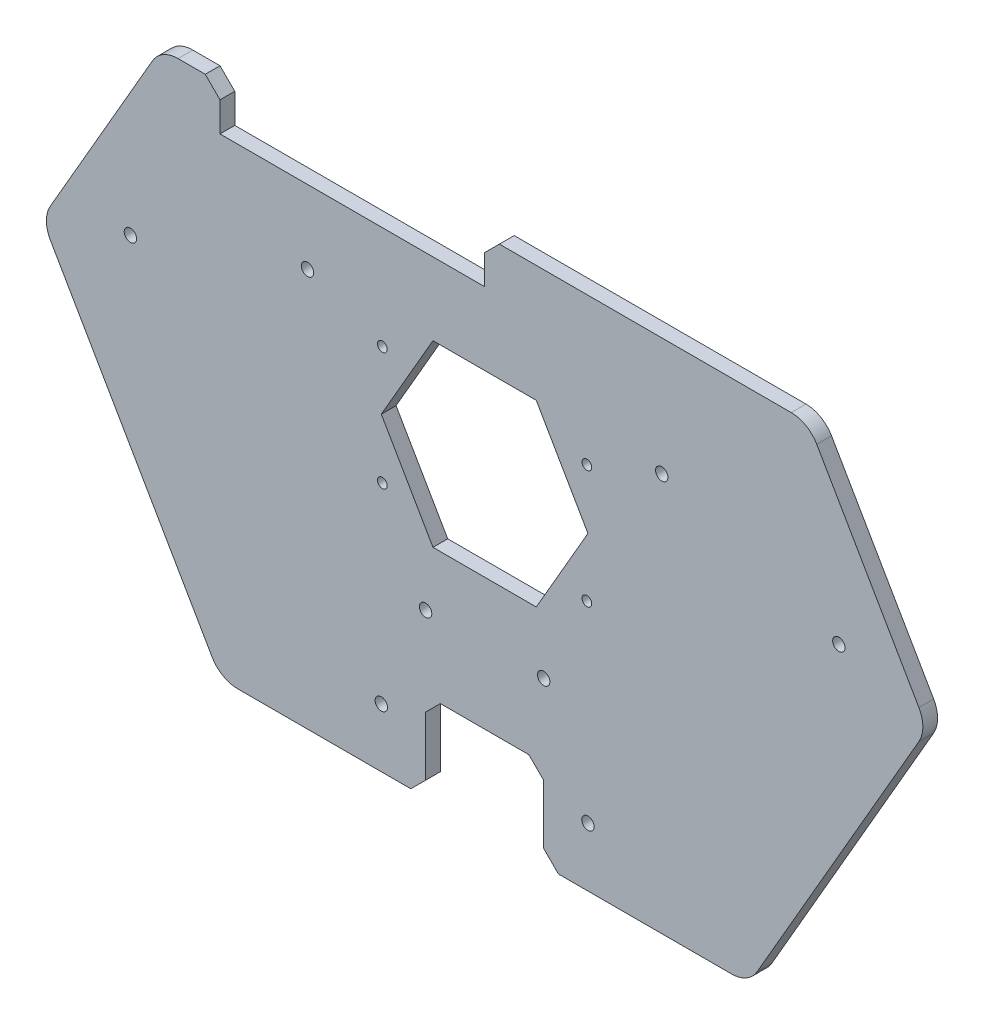
from build123d import *

# Parameters (mm, degrees)
EXTRUDE_1_DEPTH          = 5
CUT_EXTRUDE_2_DEPTH      = 199.494332413
CUT_EXTRUDE_2_DEPTH_BACK = 199.494332413
CUT_EXTRUDE_3_REACH      = 200.494
CHAMFER_1_SIZE           = 5
CUT_EXTRUDE_6_DEPTH      = 199.494332413
CUT_EXTRUDE_6_DEPTH_BACK = 199.494332413
CHAMFER_2_SIZE           = 5
CUT_EXTRUDE_7_REACH      = 185.111
SKETCH_6_R               = 2.1
FILLET_1_R               = 10
M4X0_7_1_D               = 3.3
M4X0_7_1_DEPTH           = 11.5
M4X0_7_1_TIP             = 0.991420021


with BuildPart() as part:
    # 草圖1 → 填料-伸長1 (new body)
    with BuildSketch(Plane.XY):
        Polygon((150, 0), (75, 129.903810568), (-75, 129.903810568), (-150, 0), (-75, -129.903810568), (75, -129.903810568), align=None)
    extrude(amount=EXTRUDE_1_DEPTH)

    # 草圖3 → 除料-伸長2 (cut, two sides: drawn at the far end of the back side and taken through both)
    with BuildSketch(Plane.XY.offset(5).offset(-CUT_EXTRUDE_2_DEPTH_BACK)):
        Polygon((-774.886138932, 69.903810568), (-109.641016151, 69.903810568), (-89.641016151, 69.903810568), (-89.641016151, 54.903810568), (0, 54.903810568), (0, 69.903810568), (109.641016151, 69.903810568), (774.886138932, 69.903810568), (774.886138932, 1400.394056128), (-774.886138932, 1400.394056128), align=None)
    extrude(amount=CUT_EXTRUDE_2_DEPTH + CUT_EXTRUDE_2_DEPTH_BACK, mode=Mode.SUBTRACT)

    # 草圖4 → 除料-伸長3 (cut, up to next)
    with BuildSketch(Plane.XY.offset(5), mode=Mode.PRIVATE) as cut_extrude_3_sk1:
        Polygon((35, 0), (17.5, 30.310889132), (-17.5, 30.310889132), (-35, 0), (-17.5, -30.310889132), (17.5, -30.310889132), align=None)
    cut_extrude_3_tool1 = extrude(cut_extrude_3_sk1.sketch, amount=-CUT_EXTRUDE_3_REACH, mode=Mode.PRIVATE) & part.part
    add(cut_extrude_3_tool1.solids().sort_by_distance((0, 0, 5))[0], mode=Mode.SUBTRACT)

    # 導角1
    chamfer_1_edges = [part.edges().sort_by_distance(p)[0] for p in [
        (0, 69.903810568, 2.5),
        (-89.641016151, 69.903810568, 2.5),
    ]]
    chamfer(chamfer_1_edges, length=CHAMFER_1_SIZE)

    # 草圖5 → 除料-伸長6 (cut, two sides: drawn at the far end of the back side and taken through both)
    with BuildSketch(Plane.XY.offset(5).offset(-CUT_EXTRUDE_6_DEPTH_BACK)):
        Polygon((-692.345987228, -104.903810568), (-89.43375673, -104.903810568), (-20, -104.903810568), (-20, -74.903810568), (20, -74.903810568), (20, -104.903810568), (89.43375673, -104.903810568), (692.345987228, -104.903810568), (692.345987228, -1310.728271565), (-692.345987228, -1310.728271565), align=None)
    extrude(amount=CUT_EXTRUDE_6_DEPTH + CUT_EXTRUDE_6_DEPTH_BACK, mode=Mode.SUBTRACT)

    # 導角2
    chamfer_2_edges = [part.edges().sort_by_distance(p)[0] for p in [
        (20, -104.903810568, 2.5),
        (20, -74.903810568, 2.5),
        (-20, -74.903810568, 2.5),
        (-20, -104.903810568, 2.5),
    ]]
    chamfer(chamfer_2_edges, length=CHAMFER_2_SIZE)

    # 草圖6 → 除料-伸長7 (cut, up to next)
    with BuildSketch(Plane.XY.offset(5), mode=Mode.PRIVATE) as cut_extrude_7_sk1:
        with Locations((-35, -85)):
            Circle(SKETCH_6_R)
    cut_extrude_7_tool1 = extrude(cut_extrude_7_sk1.sketch, amount=-CUT_EXTRUDE_7_REACH, mode=Mode.PRIVATE) & part.part
    # 草圖6 → 除料-伸長7 (cut, up to next)
    with BuildSketch(Plane.XY.offset(5), mode=Mode.PRIVATE) as cut_extrude_7_sk2:
        with Locations((-120, 10)):
            Circle(SKETCH_6_R)
    cut_extrude_7_tool2 = extrude(cut_extrude_7_sk2.sketch, amount=-CUT_EXTRUDE_7_REACH, mode=Mode.PRIVATE) & part.part
    # 草圖6 → 除料-伸長7 (cut, up to next)
    with BuildSketch(Plane.XY.offset(5), mode=Mode.PRIVATE) as cut_extrude_7_sk3:
        with Locations((-60, 30)):
            Circle(SKETCH_6_R)
    cut_extrude_7_tool3 = extrude(cut_extrude_7_sk3.sketch, amount=-CUT_EXTRUDE_7_REACH, mode=Mode.PRIVATE) & part.part
    # 草圖6 → 除料-伸長7 (cut, up to next)
    with BuildSketch(Plane.XY.offset(5), mode=Mode.PRIVATE) as cut_extrude_7_sk4:
        with Locations((-20, -50)):
            Circle(SKETCH_6_R)
    cut_extrude_7_tool4 = extrude(cut_extrude_7_sk4.sketch, amount=-CUT_EXTRUDE_7_REACH, mode=Mode.PRIVATE) & part.part
    cut_extrude_7_1 = cut_extrude_7_tool1.solids().sort_by_distance((-35, -85, 5))[0]
    add(cut_extrude_7_1, mode=Mode.SUBTRACT)
    cut_extrude_7_2 = cut_extrude_7_tool2.solids().sort_by_distance((-120, 10, 5))[0]
    add(cut_extrude_7_2, mode=Mode.SUBTRACT)
    cut_extrude_7_3 = cut_extrude_7_tool3.solids().sort_by_distance((-60, 30, 5))[0]
    add(cut_extrude_7_3, mode=Mode.SUBTRACT)
    cut_extrude_7_4 = cut_extrude_7_tool4.solids().sort_by_distance((-20, -50, 5))[0]
    add(cut_extrude_7_4, mode=Mode.SUBTRACT)
    cut_extrude_7 = cut_extrude_7_1 + cut_extrude_7_2 + cut_extrude_7_3 + cut_extrude_7_4  # 除料-伸長7 as one shape, for the pattern or mirror that repeats it

    # 鏡射1: 除料-伸長7 across plane
    add(cut_extrude_7.mirror(Plane(origin=(0, 0, 0), x_dir=(0, 0, 1), z_dir=(1, 0, 0))), mode=Mode.SUBTRACT)

    # 圓角1
    fillet_1_edges = [part.edges().sort_by_distance(p)[0] for p in [
        (109.641016151, 69.903810568, 2.5),
        (150, 0, 2.5),
        (89.43375673, -104.903810568, 2.5),
        (-89.43375673, -104.903810568, 2.5),
        (-150, 0, 2.5),
        (-109.641016151, 69.903810568, 2.5),
    ]]
    fillet(fillet_1_edges, radius=FILLET_1_R)

    # M4x0.7 螺紋孔1
    with Locations(Plane.XY.offset(5)):
        with Locations((-34.641016151, 20), (34.641016151, 20), (34.641016151, -20), (-34.641016151, -20)):
            Hole(M4X0_7_1_D / 2, depth=M4X0_7_1_DEPTH)
            with Locations((0, 0, -(M4X0_7_1_DEPTH + M4X0_7_1_TIP / 2))):  # 118° drill point
                Cone(0, M4X0_7_1_D / 2, M4X0_7_1_TIP, mode=Mode.SUBTRACT)


solid = part.part
